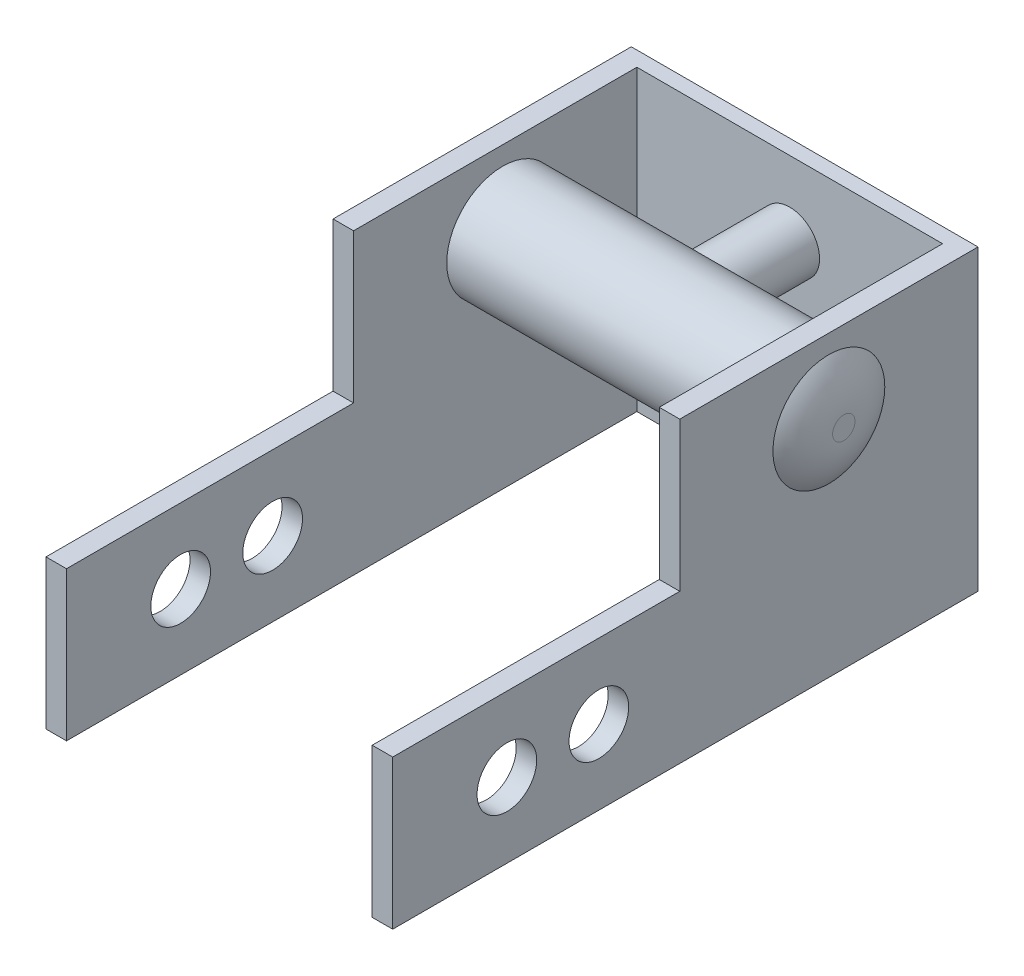
from build123d import *

# Parameters (mm, degrees)
SKETCH_1_W          = 40
SKETCH_1_H          = 40
EXTRUDE_2_DEPTH     = 46.5
SKETCH_3_W          = 38.5
SKETCH_3_H          = 20
EXTRUDE_3_DEPTH     = 2.75
SKETCH_4_W          = 38.5
SKETCH_4_H          = 20
EXTRUDE_4_DEPTH     = 2.75
CUT_EXTRUDE_1_DEPTH = 38
SKETCH_6_R          = 7.5
EXTRUDE_5_DEPTH     = 48.5
EXTRUDE_START       = -50.5
SKETCH_7_R          = 7.5
EXTRUDE_6_DEPTH     = 50.5
FILLET_1_R          = 10
SKETCH_8_R          = 4
CUT_EXTRUDE_2_DEPTH = 50.5
SKETCH_9_R          = 6
EXTRUDE_7_DEPTH     = 6
SKETCH_10_R         = 4
EXTRUDE_9_DEPTH     = 20
FILLET_3_R          = 6


# Some blends are built 0.0001 mm under size
with BuildPart() as part:
    # 草图1 → 凸台-拉伸2 (new body)
    with BuildSketch(Plane(origin=(0, 0, 0), x_dir=(0, 0, -1), z_dir=(1, 0, 0))):
        with Locations((1.325599553, 10.998115505)):
            Rectangle(SKETCH_1_W, SKETCH_1_H)
    extrude(amount=EXTRUDE_2_DEPTH)

    # 草图3 → 凸台-拉伸3 (add)
    with BuildSketch(Plane(origin=(46.5, 0, 0), x_dir=(0, 0, -1), z_dir=(1, 0, 0))):
        with Locations((-37.924400447, 0.998115505)):
            Rectangle(SKETCH_3_W, SKETCH_3_H)
    extrude(amount=-EXTRUDE_3_DEPTH)

    # 草图4 → 凸台-拉伸4 (add)
    with BuildSketch(Plane.ZY):
        with Locations((37.924400447, 0.998115505)):
            Rectangle(SKETCH_4_W, SKETCH_4_H)
    extrude(amount=-EXTRUDE_4_DEPTH)

    # 草图5 → 切除-拉伸1 (cut)
    with BuildSketch(Plane.XY.offset(18.674400447)):
        Polygon((2.75, 10.998115505), (2.75, 30.998115505), (43.75, 30.998115505), (43.75, 10.998115505), (43.75, -9.001884495), (2.75, -9.001884495), align=None)
    extrude(amount=-CUT_EXTRUDE_1_DEPTH, mode=Mode.SUBTRACT)

    # 草图6 → 凸台-拉伸5 (add)
    with BuildSketch(Plane.ZY):
        with Locations((-1.325599553, 20.998115505)):
            Circle(SKETCH_6_R)
    extrude(amount=-EXTRUDE_5_DEPTH)

    # 草图7 → 凸台-拉伸6 (add)
    with BuildSketch(Plane(origin=(48.5, 0, 0), x_dir=(0, 0, -1), z_dir=(1, 0, 0)).offset(EXTRUDE_START)):
        with Locations(Location((1.325599553, 20.998115505, 0), (0, 0, 180))):
            Circle(SKETCH_7_R)
    extrude(amount=EXTRUDE_6_DEPTH)

    # 圆角1
    # the kernel refuses this fillet: 10 mm, written as the material it takes off along each edge
    with BuildSketch(Plane(origin=(48.5, 20.998115505, -1.325599553), x_dir=(0, 0, 1), z_dir=(0, -1, 0))) as fillet_1_piece_1:
        with BuildLine():
            CenterArc((1.5, 10), FILLET_1_R, 270, 36.869897646)
            Line((1.5, 0), (1.5, -0.2))
            Line((1.5, -0.2), (7.5, -0.2))
            Line((7.5, -0.2), (7.7, 0))
            ThreePointArc((7.7, 0), (7.7, 1), (7.62, 1.84))
            Line((7.62, 1.84), (7.5, 2))
        make_face()
    revolve(axis=Axis((48.5, 20.998115505, -1.325599553), (-1, 0, 0)), mode=Mode.SUBTRACT)
    with BuildSketch(Plane(origin=(-2, 20.998115505, -1.325599553), x_dir=(0, 0, 1), z_dir=(0, 1, 0))) as fillet_1_piece_2:
        with BuildLine():
            CenterArc((1.5, 10), FILLET_1_R, 270, 36.869897646)
            Line((1.5, 0), (1.5, -0.2))
            Line((1.5, -0.2), (7.5, -0.2))
            Line((7.5, -0.2), (7.7, 0))
            ThreePointArc((7.7, 0), (7.7, 1), (7.62, 1.84))
            Line((7.62, 1.84), (7.5, 2))
        make_face()
    revolve(axis=Axis((-2, 20.998115505, -1.325599553), (1, 0, 0)), mode=Mode.SUBTRACT)

    # 草图8 → 切除-拉伸2 (cut)
    with BuildSketch(Plane(origin=(46.5, 0, 0), x_dir=(0, 0, -1), z_dir=(1, 0, 0))):
        with Locations((-41.863292437, 0.998115505)):
            Circle(SKETCH_8_R)
        with Locations((-29.525991128, 0.998115505)):
            Circle(SKETCH_8_R)
    extrude(amount=-CUT_EXTRUDE_2_DEPTH, mode=Mode.SUBTRACT)

    # 草图9 → 凸台-拉伸7 (add)
    with BuildSketch(Plane(origin=(0, 0, -21.325599553), x_dir=(-1, 0, 0), z_dir=(0, 0, -1))):
        with Locations((-23.25, 20.998115505)):
            Circle(SKETCH_9_R)
    extrude(amount=EXTRUDE_7_DEPTH)

    # 草图10 → 凸台-拉伸9 (add)
    with BuildSketch(Plane(origin=(0, 0, -27.325599553), x_dir=(-1, 0, 0), z_dir=(0, 0, -1))):
        with Locations((-23.25, 20.998115505)):
            Circle(SKETCH_10_R)
    extrude(amount=-EXTRUDE_9_DEPTH)

    # 圆角3
    fillet_3_edges = [part.edges().sort_by_distance(p)[0] for p in [
        (29.25, 20.998115505, -27.325599553),
    ]]
    fillet(fillet_3_edges, radius=FILLET_3_R - 0.0001)  # a hair under: the kernel refuses the full size


solid = part.part
